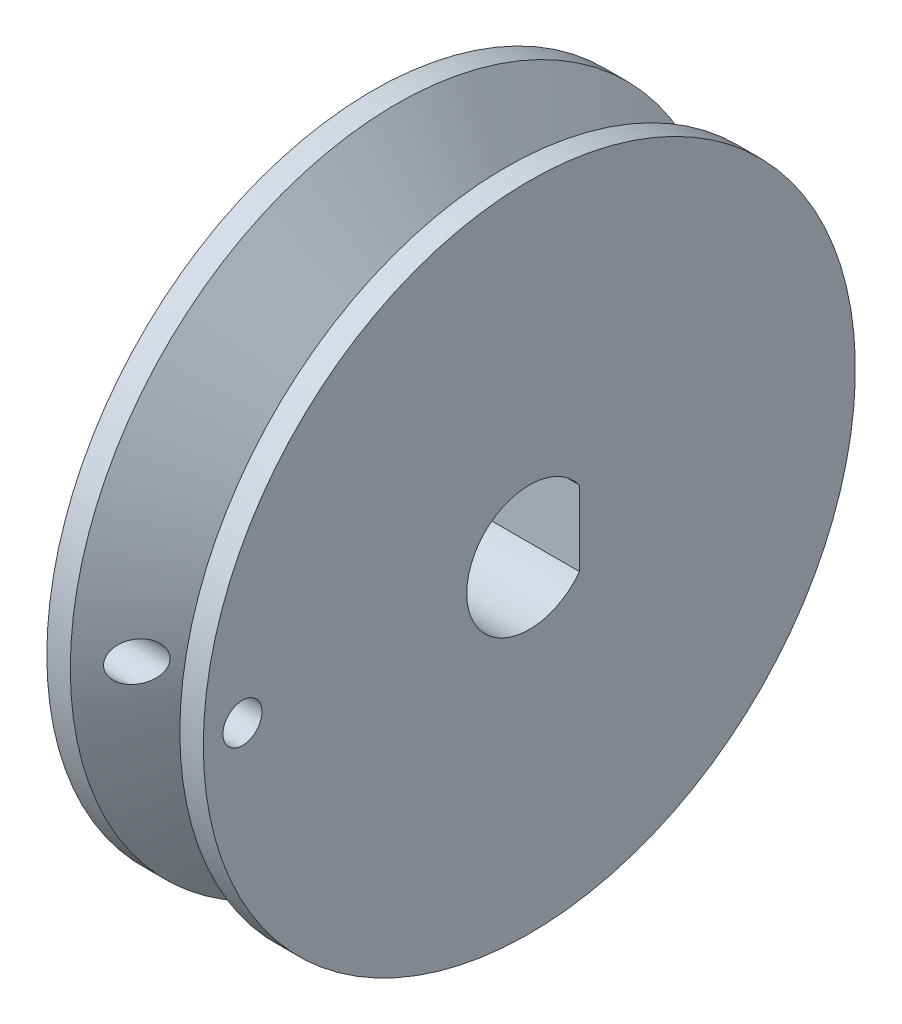
from build123d import *

# Parameters (mm, degrees)
CUT_EXTRUDE1_DEPTH      = 24.708556472
CUT_EXTRUDE1_DEPTH_BACK = 24.708556472
CUT_EXTRUDE2_DEPTH      = 24.708556472
CUT_EXTRUDE2_DEPTH_BACK = 24.708556472
SKETCH4_R               = 0.9525


with BuildPart() as part:
    # Sketch2 → Revolve1 (revolve)
    with BuildSketch(Plane.XY):
        Polygon((0, 0), (0, 15.875), (1.143, 15.875), (3.81, 12.065), (6.477, 15.875), (7.62, 15.875), (7.62, 0), align=None)
    revolve(axis=Axis((0, 0, 0), (1, 0, 0)))

    # Sketch3 → Cut-Extrude1 (cut, two sides: drawn at the far end of the back side and taken through both)
    with BuildSketch(Plane(origin=(7.62, 0, 0), x_dir=(0, 0, -1), z_dir=(1, 0, 0)).offset(-CUT_EXTRUDE1_DEPTH_BACK)):
        with BuildLine():
            Line((2.44094, -1.825408425), (2.44094, 1.825408425))
            ThreePointArc((2.44094, 1.825408425), (-3.048, 0), (2.44094, -1.825408425))
        make_face()
    extrude(amount=CUT_EXTRUDE1_DEPTH + CUT_EXTRUDE1_DEPTH_BACK, mode=Mode.SUBTRACT)

    # Sketch4 → Cut-Extrude2 (cut, two sides: drawn at the far end of the back side and taken through both)
    with BuildSketch(Plane(origin=(7.62, 0, 0), x_dir=(0, 0, -1), z_dir=(1, 0, 0)).offset(-CUT_EXTRUDE2_DEPTH_BACK)):
        with Locations((-13.97, 0)):
            Circle(SKETCH4_R)
    extrude(amount=CUT_EXTRUDE2_DEPTH + CUT_EXTRUDE2_DEPTH_BACK, mode=Mode.SUBTRACT)


solid = part.part
